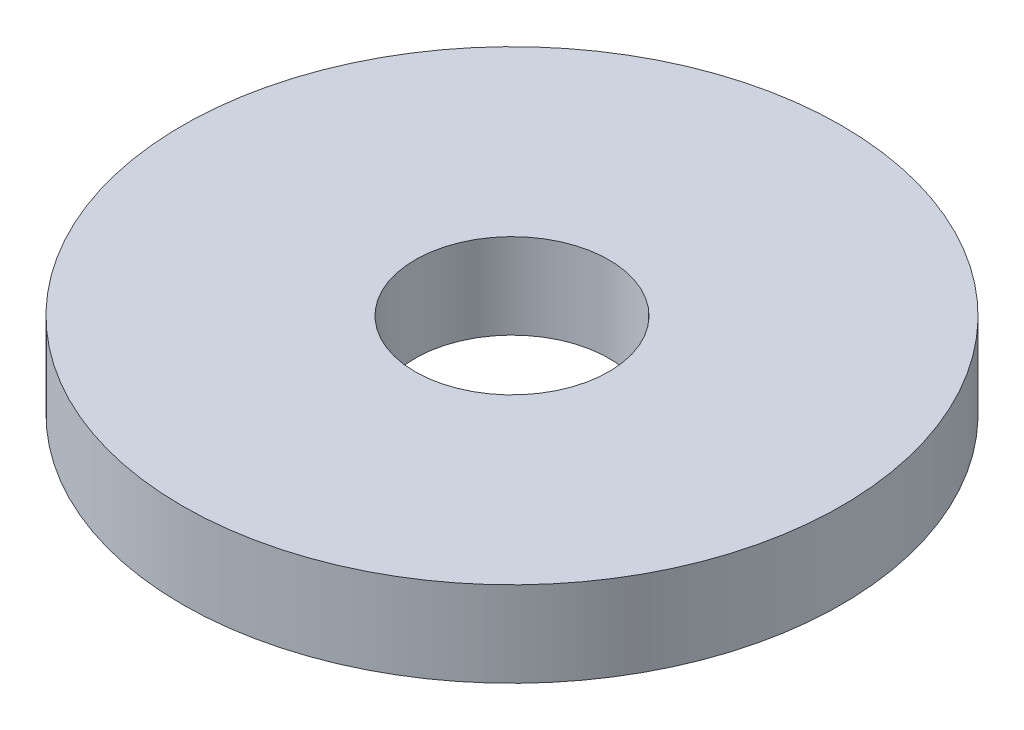
from build123d import *

# Parameters (mm, degrees)
SKETCH1_R           = 85
BOSS_EXTRUDE1_DEPTH = 22
SKETCH2_R           = 25
CUT_EXTRUDE1_DEPTH  = 123.204746225


with BuildPart() as part:
    # Sketch1 → Boss-Extrude1 (new body)
    with BuildSketch(Plane(origin=(0, 0, 0), x_dir=(1, 0, 0), z_dir=(0, 1, 0))):
        Circle(SKETCH1_R)
    extrude(amount=BOSS_EXTRUDE1_DEPTH)

    # Sketch2 → Cut-Extrude1 (cut, through all)
    with BuildSketch(Plane(origin=(0, 0, 0), x_dir=(1, 0, 0), z_dir=(0, 1, 0))):
        Circle(SKETCH2_R)
    extrude(amount=CUT_EXTRUDE1_DEPTH, mode=Mode.SUBTRACT)


solid = part.part
